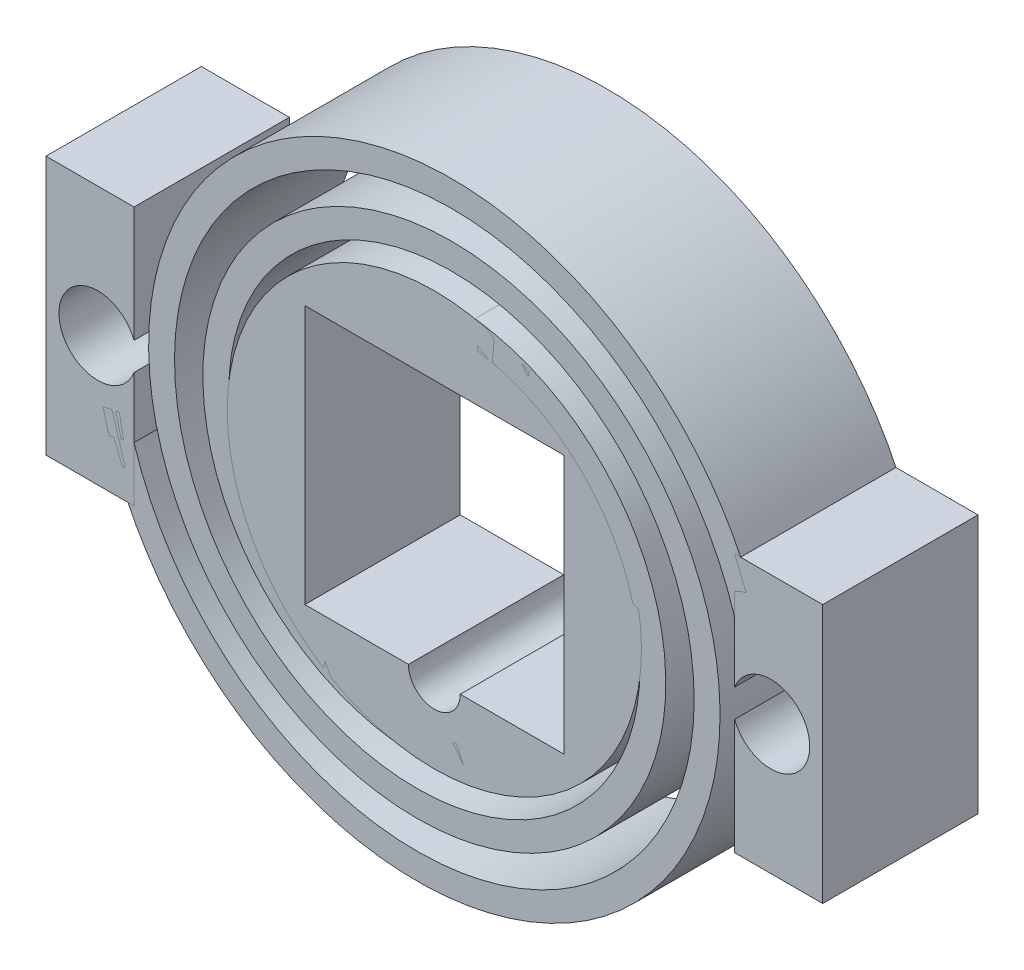
from build123d import *

# Parameters (mm, degrees)
ESQUISSE1_R                  = 8
BOSS_EXTRU_1_DEPTH           = 6
BOSS_EXTRU_1_2_DEPTH         = 6
BOSS_EXTRU_1_3_DEPTH         = 6
BALAYAGE2_DEPTH              = 6
R_P_TITION_CIRCULAIRE5_COUNT = 2


# Read off the part's stored shape, not the designer's step: Balayage2
with BuildPart() as part:
    # Esquisse1 → Boss.-Extru.1 (new body)
    with BuildSketch(Plane.XY):
        with Locations((13, 0)):
            Circle(ESQUISSE1_R)
        with BuildLine():
            Line((8, 5), (18, 5))
            Line((18, 5), (18, -5))
            Line((18, -5), (14, -5))
            ThreePointArc((14, -5), (13, -6), (12, -5))
            Line((12, -5), (8, -5))
            Line((8, -5), (8, 5))
        make_face(mode=Mode.SUBTRACT)
    extrude(amount=BOSS_EXTRU_1_DEPTH)


with BuildPart() as body_2:
    # Esquisse1 → Boss.-Extru.1 2 (new body)
    with BuildSketch(Plane.XY):
        with BuildLine():
            Line((1.4, -0.538516481), (1.4, -5))
            Line((1.4, -5), (-2, -5))
            Line((-2, -5), (-2, 5))
            Line((-2, 5), (1.4, 5))
            Line((1.4, 5), (1.4, 0.538516481))
            ThreePointArc((1.4, 0.538516481), (-1.5, 0), (1.4, -0.538516481))
        make_face()
    extrude(amount=BOSS_EXTRU_1_2_DEPTH)


with BuildPart() as body_3:
    # Esquisse1 → Boss.-Extru.1 3 (new body)
    with BuildSketch(Plane.XY):
        with BuildLine():
            Line((24.6, 5), (28, 5))
            Line((28, 5), (28, -5))
            Line((28, -5), (24.6, -5))
            Line((24.6, -5), (24.6, -0.538516481))
            ThreePointArc((24.6, -0.538516481), (27.5, 0), (24.6, 0.538516481))
            Line((24.6, 0.538516481), (24.6, 5))
        make_face()
    extrude(amount=BOSS_EXTRU_1_3_DEPTH)


with BuildPart() as body_4:
    # Balayage2 outline → Balayage2 (new body)
    with BuildSketch(Plane.XY):
        with BuildLine():
            add(Edge.make_bspline(
                [(1.176968024, -2.057607761), (1.532004388, -3.587957641), (2.189865068, -5.034027877), (3.979815148, -7.532182315), (5.116641113, -8.591312436), (7.669785443, -10.175252194), (9.093237562, -10.704809661), (11.990976631, -11.176692715), (13.473702859, -11.120669906), (16.263831198, -10.460107284), (17.579689694, -9.853846655), (19.846925987, -8.213166384), (20.805476635, -7.173893884), (22.233242289, -4.847061431), (22.707233655, -3.552240546), (23.121493975, -0.923369554), (23.063390164, 0.419249589), (22.45254668, 2.93893067), (21.898011427, 4.12456005), (20.40682269, 6.160994259), (19.465201987, 7.019045382), (17.364853716, 8.290842442), (16.19872889, 8.709387144), (13.838812964, 9.066299138), (12.636316417, 9.006259466), (10.387056724, 8.445443563), (9.331612409, 7.942784448), (7.525828014, 6.601383874), (6.768170621, 5.757547164), (5.652068324, 3.88391657), (5.288810258, 2.846576338), (4.988876636, 0.755736303), (5.050655525, -0.306614956), (5.561023224, -2.285484703), (6.011599577, -3.210802352), (7.202802422, -4.786142294), (7.948671532, -5.443550133), (9.595257016, -6.404334039), (10.503687336, -6.712526897), (12.325277053, -6.955998018), (13.247448354, -6.892755757), (14.101707233, -6.663093425)],
                knots=[0, 0, 0, 0, 0.03125, 0.03125, 0.0625, 0.0625, 0.09375, 0.09375, 0.125, 0.125, 0.15625, 0.15625, 0.1875, 0.1875, 0.21875, 0.21875, 0.25, 0.25, 0.28125, 0.28125, 0.3125, 0.3125, 0.34375, 0.34375, 0.375, 0.375, 0.40625, 0.40625, 0.4375, 0.4375, 0.46875, 0.46875, 0.5, 0.5, 0.53125, 0.53125, 0.5625, 0.5625, 0.59375, 0.59375, 0.625, 0.625, 0.625, 0.625], degree=3))
            Line((1.176968024, -2.057607761), (0.20283815, -2.28359668))
            add(Edge.make_bspline(
                [(0.20283815, -2.28359668), (0.587899547, -3.943370079), (1.299562511, -5.508402457), (3.244355099, -8.222666506), (4.476488928, -9.37097856), (7.255571989, -11.095089853), (8.801271592, -11.670436106), (11.961474623, -12.185061799), (13.574676606, -12.12440674), (16.623608593, -11.402574035), (18.058187903, -10.74195019), (20.540916475, -8.945331426), (21.588237339, -7.810273925), (23.155141411, -5.256690418), (23.674333473, -3.839325304), (24.130013575, -0.947617294), (24.066590292, 0.525529804), (23.393047559, 3.303847235), (22.783462891, 4.607973348), (21.135017951, 6.859166444), (20.097036779, 7.805496117), (17.768952826, 9.215192969), (16.4799222, 9.678230839), (13.856709211, 10.074965353), (12.523616999, 10.008773842), (10.015914123, 9.383521083), (8.842241207, 8.824975592), (6.822583586, 7.324704477), (5.977245106, 6.383799631), (4.724755471, 4.281215234), (4.317871796, 3.120519095), (3.980082868, 0.765801128), (4.049042608, -0.427236198), (4.626005391, -2.66432452), (5.133511709, -3.707544237), (6.485608996, -5.495666384), (7.329437517, -6.24001367), (9.206522357, -7.335296089), (10.238884009, -7.686025568), (12.325106954, -7.964868912), (13.378089394, -7.89314094), (14.361326278, -7.628804538)],
                knots=[0, 0, 0, 0, 0.03125, 0.03125, 0.0625, 0.0625, 0.09375, 0.09375, 0.125, 0.125, 0.15625, 0.15625, 0.1875, 0.1875, 0.21875, 0.21875, 0.25, 0.25, 0.28125, 0.28125, 0.3125, 0.3125, 0.34375, 0.34375, 0.375, 0.375, 0.40625, 0.40625, 0.4375, 0.4375, 0.46875, 0.46875, 0.5, 0.5, 0.53125, 0.53125, 0.5625, 0.5625, 0.59375, 0.59375, 0.625, 0.625, 0.625, 0.625], degree=3))
            Line((14.361326278, -7.628804538), (14.101707233, -6.663093425))
        make_face()
    extrude(amount=BALAYAGE2_DEPTH)


with BuildPart() as r_p_tition_circulaire5_1:
    # Répétition circulaire5: pattern copy
    add(body_4.part.rotate(Axis((13, 0, 0), (0, 0, 1)), 1 * 360 / R_P_TITION_CIRCULAIRE5_COUNT))


solid = Compound([part.part, body_2.part, body_3.part, body_4.part, r_p_tition_circulaire5_1.part])
